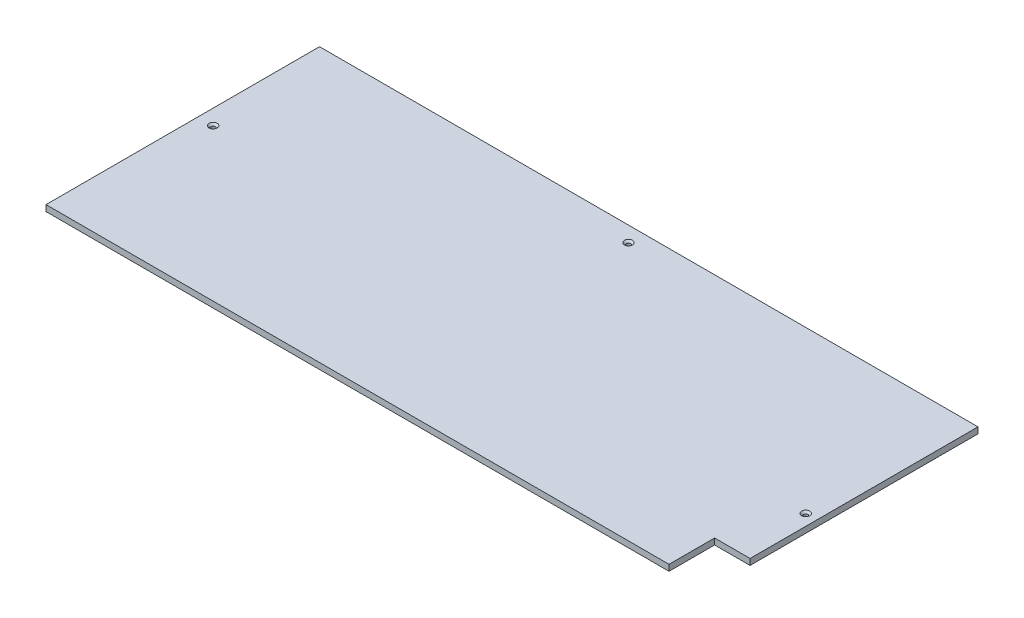
from build123d import *

# Parameters (mm, degrees)
SKETCH1_W                                       = 650
SKETCH1_H                                       = 270
BOSS_EXTRUDE1_DEPTH                             = 6
SKETCH2_W                                       = 47.933434696
SKETCH2_H                                       = 80.199938578
CUT_EXTRUDE1_DEPTH                              = 358.995810031
CSK_FOR_M4_FLAT_HEAD_MACHINE_SCREW1_D           = 4.2
CSK_FOR_M4_FLAT_HEAD_MACHINE_SCREW1_CSINK_D     = 8
CSK_FOR_M4_FLAT_HEAD_MACHINE_SCREW1_CSINK_ANGLE = 90


with BuildPart() as part:
    # Sketch1 → Boss-Extrude1 (new body)
    with BuildSketch(Plane(origin=(0, 0, 0), x_dir=(1, 0, 0), z_dir=(0, 1, 0))):
        with Locations((0, -15)):
            Rectangle(SKETCH1_W, SKETCH1_H)
    extrude(amount=BOSS_EXTRUDE1_DEPTH)

    # Sketch2 → Cut-Extrude1 (cut, through all)
    with BuildSketch(Plane(origin=(0, 6, 0), x_dir=(1, 0, 0), z_dir=(0, 1, 0))):
        with Locations((313.966717348, -145.099969289)):
            Rectangle(SKETCH2_W, SKETCH2_H)
    extrude(amount=-CUT_EXTRUDE1_DEPTH, mode=Mode.SUBTRACT)

    # CSK for M4 Flat Head Machine Screw1 (through all)
    with Locations(Plane(origin=(0, 6, 0), x_dir=(1, 0, 0), z_dir=(0, 1, 0))):
        with Locations((-310, 0), (-5, 105), (314, -39)):
            CounterSinkHole(CSK_FOR_M4_FLAT_HEAD_MACHINE_SCREW1_D / 2, CSK_FOR_M4_FLAT_HEAD_MACHINE_SCREW1_CSINK_D / 2, counter_sink_angle=CSK_FOR_M4_FLAT_HEAD_MACHINE_SCREW1_CSINK_ANGLE)


solid = part.part
